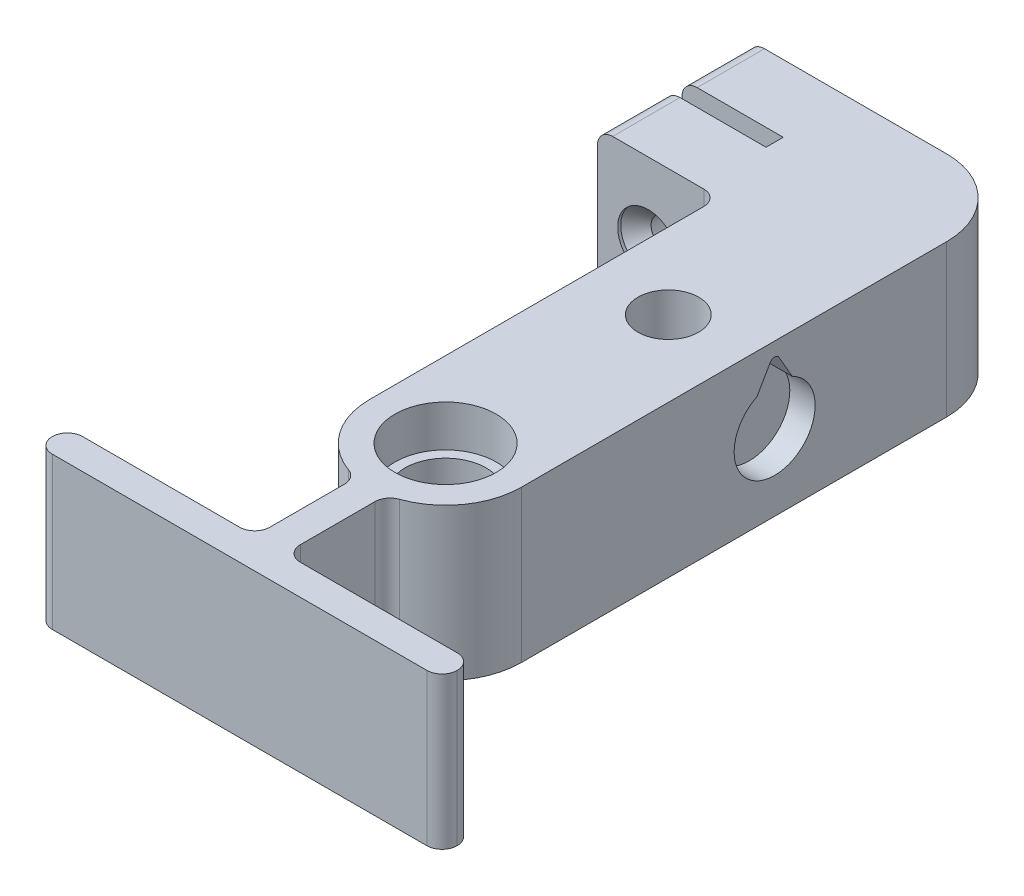
from build123d import *

# Parameters (mm, degrees)
SKETCH1_R           = 4
BOSS_EXTRUDE1_DEPTH = 7.5
SKETCH2_R           = 5
CUT_EXTRUDE1_DEPTH  = 4.1
SKETCH12_R          = 5
SKETCH12_R_2        = 4
CUT_EXTRUDE10_DEPTH = 1
CUT_EXTRUDE3_DEPTH  = 2.5
BOSS_EXTRUDE3_DEPTH = 15
CUT_EXTRUDE7_REACH  = 45.603
SKETCH7_W           = 10
SKETCH7_H           = 1.7
CUT_EXTRUDE8_REACH  = 76.732
SKETCH8_R           = 1.5
CUT_EXTRUDE9_DEPTH  = 3
CUT_EXTRUDE11_DEPTH = 1.7
BOSS_EXTRUDE2_START = -15
BOSS_EXTRUDE2_DEPTH = 15
FILLET8_R           = 1.5
CUT_EXTRUDE12_REACH = 45.829
SKETCH19_R          = 3


with BuildPart() as part:
    # Sketch1 → Boss-Extrude1 (new, symmetric)
    with BuildSketch(Plane(origin=(0, 0, 0), x_dir=(1, 0, 0), z_dir=(0, 1, 0))):
        with BuildLine():
            Line((7.5, 21), (-7.5, 21))
            Line((-7.5, 21), (-7.5, -13.499999984))
            ThreePointArc((-7.5, -13.499999984), (-8e-09, -21), (7.5, -13.5))
            Line((7.5, -13.5), (7.5, 21))
        make_face()
        with Locations(Location((0, -13.5, 0), (0, 0, 270))):
            Circle(SKETCH1_R, mode=Mode.SUBTRACT)
    extrude(amount=BOSS_EXTRUDE1_DEPTH, both=True)

    # Sketch2 → Cut-Extrude1 (cut)
    with BuildSketch(Plane(origin=(0, 7.5, 0), x_dir=(1, 0, 0), z_dir=(0, 1, 0))):
        with Locations(Location((0, -13.5, 0), (0, 0, 270))):
            Circle(SKETCH2_R)
    cut_extrude1 = extrude(amount=-CUT_EXTRUDE1_DEPTH, mode=Mode.SUBTRACT)

    # Mirror1: Cut-Extrude1 across plane
    add(cut_extrude1.mirror(Plane.ZX), mode=Mode.SUBTRACT)

    # Sketch12 → Cut-Extrude10 (cut)
    with BuildSketch(Plane.XZ.offset(3.4)):
        with Locations(Location((0, 13.5, 0), (0, 0, 90))):
            Circle(SKETCH12_R)
        with Locations(Location((0, 13.5, 0), (0, 0, 270))):
            Circle(SKETCH12_R_2, mode=Mode.SUBTRACT)
    extrude(amount=-CUT_EXTRUDE10_DEPTH, mode=Mode.SUBTRACT)

    # Sketch4 → Cut-Extrude3 (cut)
    with BuildSketch(Plane(origin=(7.5, 0, 0), x_dir=(0, 0, -1), z_dir=(1, 0, 0))):
        with BuildLine():
            Line((13.25, 3.596873642), (11.933012728, 5.87796251))
            ThreePointArc((11.933012728, 5.87796251), (11.500000041, 6.127962556), (11.066987313, 5.877962581))
            Line((11.066987313, 5.877962581), (9.75, 3.596873642))
            ThreePointArc((9.75, 3.596873642), (11.5, -4), (13.25, 3.596873642))
        make_face()
    cut_extrude3 = extrude(amount=-CUT_EXTRUDE3_DEPTH, mode=Mode.SUBTRACT)

    # Mirror2: Cut-Extrude3 across plane
    add(cut_extrude3.mirror(Plane(origin=(0, 0, 0), x_dir=(0, 0, 1), z_dir=(1, 0, 0))), mode=Mode.SUBTRACT)

    # Sketch18 → Boss-Extrude3 (add)
    with BuildSketch(Plane.XZ.offset(7.5)):
        with BuildLine():
            Line((-19.5, -21), (-19.5, -36))
            Line((-19.5, -36), (0, -36))
            ThreePointArc((0, -36), (5.303300859, -33.803300859), (7.5, -28.5))
            Line((7.5, -28.5), (7.5, -21))
            Line((7.5, -21), (-19.5, -21))
        make_face()
    extrude(amount=-BOSS_EXTRUDE3_DEPTH)

    # Sketch7 → Cut-Extrude7 (cut, up to next)
    with BuildSketch(Plane(origin=(0, 7.5, 0), x_dir=(1, 0, 0), z_dir=(0, 1, 0)), mode=Mode.PRIVATE) as cut_extrude7_sk1:
        with Locations((-14.5, 28.5)):
            Rectangle(SKETCH7_W, SKETCH7_H)
    cut_extrude7_tool1 = extrude(cut_extrude7_sk1.sketch, amount=-CUT_EXTRUDE7_REACH, mode=Mode.PRIVATE) & part.part
    add(cut_extrude7_tool1.solids().sort_by_distance((-14.5, 7.5, -28.5))[0], mode=Mode.SUBTRACT)

    # Cut-Extrude8: up to this face of the body (flat: up to its plane)
    cut_extrude8_end = Plane(part.part.faces().sort_by_distance((-13.5, 0, -21))[0])
    # Sketch8 → Cut-Extrude8 (cut, up to the picked face)
    with BuildSketch(Plane(origin=(-40.245190528, 0, -36), x_dir=(1, 0, 0), z_dir=(0, 0, 1)), mode=Mode.PRIVATE) as cut_extrude8_sk1:
        with Locations(Location((25.745190528, 0, 0), (0, 0, 180))):
            Circle(SKETCH8_R)
    cut_extrude8_tool1 = split(extrude(cut_extrude8_sk1.sketch, amount=CUT_EXTRUDE8_REACH, mode=Mode.PRIVATE), bisect_by=cut_extrude8_end, keep=Keep.BOTH, mode=Mode.PRIVATE)
    add(cut_extrude8_tool1.solids().sort_by(Axis((-14.5, 0, -36), (0, 0, 1)))[0], mode=Mode.SUBTRACT)

    # Sketch10 → CSK for M3 Flat Head Machine Screw1 (revolve, cut)
    with BuildSketch(Plane(origin=(-14.5, 0, -21), x_dir=(0, -1, 0), z_dir=(1, 0, 0))):
        Polygon((0, 0), (0, 5.901290929), (1.5, 5), (1.5, 1.8), (3, 0.3), (3, 0), align=None)
    revolve(axis=Axis((-14.5, 0, -14.65), (0, 0, -1)), mode=Mode.SUBTRACT)

    # Sketch11 → Cut-Extrude9 (cut)
    with BuildSketch(Plane(origin=(15, 0, -36), x_dir=(1, 0, 0), z_dir=(0, 0, 1))):
        Polygon((-29.5, -3.464101615), (-26.5, -1.732050808), (-26.5, 1.732050808), (-29.5, 3.464101615), (-32.5, 1.732050808), (-32.5, -1.732050808), align=None)
    extrude(amount=CUT_EXTRUDE9_DEPTH, mode=Mode.SUBTRACT)

    # Sketch13 → Cut-Extrude11 (cut)
    with BuildSketch(Plane(origin=(-44.653589838, 0, -29.35), x_dir=(1, 0, 0), z_dir=(0, 0, 1))):
        Polygon((35.153589838, 7.5), (42.653589838, 0), (35.153589838, -7.5), align=None)
    extrude(amount=CUT_EXTRUDE11_DEPTH, mode=Mode.SUBTRACT)

    # Sketch16 → Boss-Extrude2 (add)
    with BuildSketch(Plane.XZ.offset(7.5).offset(BOSS_EXTRUDE2_START)):
        with BuildLine():
            Line((1.5, 30.848469228), (-1.5, 30.848469228))
            Line((-1.5, 30.848469228), (-1.5, 20.848469228))
            ThreePointArc((-1.5, 20.848469228), (0, 21), (1.5, 20.848469228))
            Line((1.5, 20.848469228), (1.5, 30.848469228))
        make_face()
        Polygon((-20, 30.848469228), (-1.5, 30.848469228), (1.5, 30.848469228), (20, 30.848469228), (20, 33.848469228), (-20, 33.848469228), align=None)
    extrude(amount=BOSS_EXTRUDE2_DEPTH)

    # Fillet8
    fillet8_edges = [part.edges().sort_by_distance(p)[0] for p in [
        (20, 0, 30.848469228),
        (20, 0, 33.848469228),
        (-20, 0, 33.848469228),
        (-20, 0, 30.848469228),
        (-1.5, 0, 30.848469228),
        (-1.5, 0, 20.848469228),
        (1.5, 0, 20.848469228),
        (1.5, 0, 30.848469228),
        (-19.5, -7.5, -24.325),
        (-19.5, 7.5, -24.325),
        (-19.5, 7.5, -32.675),
        (-19.5, -7.5, -32.675),
        (-7.5, 0, -21),
    ]]
    fillet(fillet8_edges, radius=FILLET8_R - 0.0001)  # a hair under: the kernel refuses the full size

    # Sketch19 → Cut-Extrude12 (cut, up to next)
    with BuildSketch(Plane.XZ.offset(7.5), mode=Mode.PRIVATE) as cut_extrude12_sk1:
        with Locations(Location((0, -8.5, 0), (0, 0, 270))):
            Circle(SKETCH19_R)
    cut_extrude12_tool1 = extrude(cut_extrude12_sk1.sketch, amount=-CUT_EXTRUDE12_REACH, mode=Mode.PRIVATE) & part.part
    add(cut_extrude12_tool1.solids().sort_by_distance((0, -7.5, -8.5))[0], mode=Mode.SUBTRACT)


solid = part.part
